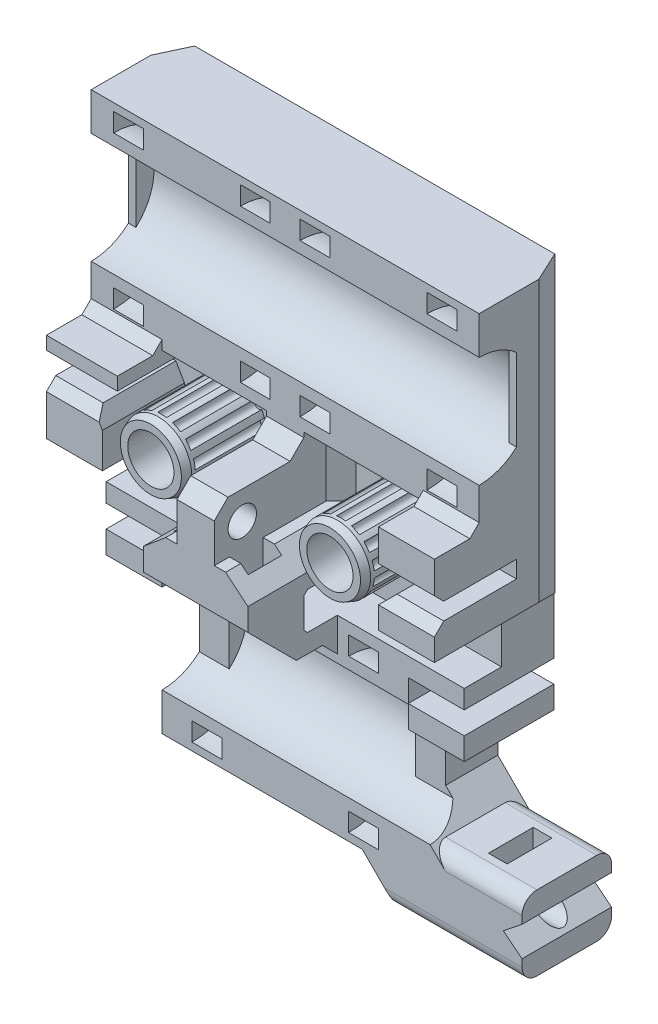
from build123d import *
from OCP.BRepFilletAPI import BRepFilletAPI_MakeChamfer
from build123d.topology import SkipClean

# Parameters (mm, degrees)
BODY_DEPTH                    = 26
SKETCH6_R                     = 4.4563
BELDMOUNT_DEPTH               = 11
SKETCH7_R                     = 3.1
BELTMOUNTCUT_DEPTH            = 5
SKETCH5_R                     = 1.85
MOUNTHOLE_DEPTH               = 26
BEARINGMOUNTHOLESTOP_START    = -3
BEARINGMOUNTHOLESTOP_DEPTH    = 4
BEARINGMOUNTHOLESBOTTOM_START = -8.5
BEARINGMOUNTHOLESBOTTOM_DEPTH = 4
COPYBEARINGMOUNTHOLES_COUNT   = 2
COPYBEARINGMOUNTHOLES_PITCH   = 17
BOTTOMCUT_DEPTH               = 12
RIB2_REACH                    = 67.622
SKETCH18_WALL_W               = 144.222327992
SKETCH18_WALL_H               = 1
RIB3_REACH                    = 64.47
SKETCH19_WALL_W               = 137.91826644
SKETCH19_WALL_H               = 4
BOSS_EXTRUDE5_DEPTH           = 7
CHAMFER3_SIZE                 = 2.5
CHAMFER3_SIZE2                = 2.979383981
RIB4_DEPTH                    = 2.5
SKETCH25_W                    = 2.5
SKETCH25_H                    = 4.5
WIREZIP_DEPTH                 = 18
BOSS_EXTRUDE6_START           = -12
SKETCH26_W                    = 7.5
SKETCH26_H                    = 3
BOSS_EXTRUDE6_DEPTH           = 12
SKETCH28_R                    = 1.9
CUT_EXTRUDE8_DEPTH            = 67.592044884
SKETCH29_R                    = 0.6
BELT_ROWS_DEPTH               = 9.5
BELT_TONEL_DEPTH              = 68.514816462
ENDSTOPFINGER_DEPTH           = 12
SKETCH20_W                    = 7.5
SKETCH20_H                    = 5.5
SKETCH20_H_2                  = 4.2
SKETCH20_W_2                  = 9.5
SKETCH20_H_3                  = 3
SKETCH20_H_4                  = 6.7
BELTFIX_DEPTH                 = 11
CHAMFER5_SIZE                 = 2
CHAMFER5_SIZE2                = 1.154700538
CHAMFER2_SIZE                 = 1.25
SKETCH34_R                    = 1.6
CUT_EXTRUDE11_DEPTH           = 12
CUT_EXTRUDE9_START            = -5
CUT_EXTRUDE9_DEPTH            = 2.5
CHAMFER14_SIZE                = 5
CHAMFER7_SIZE                 = 4
CHAMFER7_SIZE2                = 1.865230633
MOUNTCHAMFER_SIZE2            = 0.363970234
MOUNTCHAMFER_SIZE             = 1
CHAMFER15_SIZE                = 3
CHAMFER18_SIZE                = 1.25
FILLET1_R                     = 2
CHAMFER19_SIZE                = 2


with BuildPart() as part:
    # Sketch3 → Body (new body)
    with BuildSketch(Plane(origin=(60, 0, 0), x_dir=(0, 0, -1), z_dir=(1, 0, 0))):
        with BuildLine():
            Line((-12.000000104, 37.575003755), (-12.000000104, 32.000003755))
            Line((-12.000000104, 32.000003755), (-7.000000216, 32.000003755))
            Line((-7.000000216, 32.000003755), (-7.000000216, 13.000004783))
            Line((-7.000000216, 13.000004783), (-12.000000104, 13.000004783))
            Line((-12.000000104, 13.000004783), (-12.000000104, 7.425003755))
            ThreePointArc((-12.000000104, 7.425003755), (-4.575000104, 3.755e-06), (-12.000000104, -7.424996245))
            Line((-12.000000104, -7.424996245), (-12.000000104, -12.499996245))
            Line((-12.000000104, -12.499996245), (0, -12.499996245))
            Line((0, -12.499996245), (0, 57.500003755))
            Line((0, 57.500003755), (-12.000000104, 57.500003755))
            Line((-12.000000104, 57.500003755), (-12.000000104, 52.425003755))
            ThreePointArc((-12.000000104, 52.425003755), (-4.575000104, 45.000003755), (-12.000000104, 37.575003755))
        make_face()
    extrude(amount=BODY_DEPTH)

    # Sketch6 → BeldMount (add)
    with BuildSketch(Plane.XY.offset(7.000000216)):
        with Locations(Location((72, 24.575003755, 0), (0, 0, 90))):
            Circle(SKETCH6_R)
    extrude(amount=BELDMOUNT_DEPTH)

    # Sketch7 → BeltMountCut (cut)
    with BuildSketch(Plane.XY.offset(18.000000216)):
        with Locations((72, 24.575003755)):
            Circle(SKETCH7_R)
    extrude(amount=-BELTMOUNTCUT_DEPTH, mode=Mode.SUBTRACT)

    # Sketch5 → MountHole (cut)
    with BuildSketch(Plane(origin=(0, 0, 0), x_dir=(-1, 0, 0), z_dir=(0, 0, -1))):
        with Locations((-72, 24.575003755)):
            Circle(SKETCH5_R)
    extrude(amount=-MOUNTHOLE_DEPTH, mode=Mode.SUBTRACT)

    # Sketch12 → BearingMountHolesTop (cut)
    with BuildSketch(Plane(origin=(86, 0, 0), x_dir=(0, 0, -1), z_dir=(1, 0, 0)).offset(BEARINGMOUNTHOLESTOP_START)):
        with BuildLine():
            Line((-12.000000104, 56.47731591), (-12.000000104, 53.982248966))
            ThreePointArc((-12.000000104, 53.982248966), (-3.017754893, 45.000003755), (-12.000000104, 36.017758544))
            Line((-12.000000104, 36.017758544), (-12.000000104, 33.5226916))
            ThreePointArc((-12.000000104, 33.5226916), (-0.522687949, 45.000003755), (-12.000000104, 56.47731591))
        make_face()
    bearingmountholestop = extrude(amount=-BEARINGMOUNTHOLESTOP_DEPTH, mode=Mode.SUBTRACT)

    # Sketch15 → BearingMountHolesBottom (cut)
    with BuildSketch(Plane.ZY.offset(-60).offset(BEARINGMOUNTHOLESBOTTOM_START)):
        with BuildLine():
            Line((12.000000104, 8.999900377), (12.000000104, 11.477181665))
            ThreePointArc((12.000000104, 11.477181665), (0.522822195, 3.755e-06), (12.000000104, -11.477174154))
            Line((12.000000104, -11.477174154), (12.000000104, -8.999892867))
            ThreePointArc((12.000000104, -8.999892867), (3.000103482, 3.755e-06), (12.000000104, 8.999900377))
        make_face()
    extrude(amount=-BEARINGMOUNTHOLESBOTTOM_DEPTH, mode=Mode.SUBTRACT)

    # CopyBearingMountHoles: BearingMountHolesTop ×2
    with Locations(*[(-i * COPYBEARINGMOUNTHOLES_PITCH, 0, 0) for i in range(1, COPYBEARINGMOUNTHOLES_COUNT)]):
        add(bearingmountholestop, mode=Mode.SUBTRACT)

    # Sketch16 → BottomCut (cut)
    with BuildSketch(Plane(origin=(0, 0, 0), x_dir=(-1, 0, 0), z_dir=(0, 0, -1))):
        Polygon((-86, 20.000003755), (-84, 20.000003755), (-84, 10.500003755), (-76.5, 10.500003755), (-76.5, -12.499996245), (-86, -12.499996245), align=None)
    extrude(amount=-BOTTOMCUT_DEPTH, mode=Mode.SUBTRACT)

    # Sketch18 wall → Rib2 (add, up to next)
    with BuildSketch(Plane(origin=(86, 45.000003756, 7), x_dir=(0, -1, 0), z_dir=(0, 0, -1)), mode=Mode.PRIVATE) as rib2_sk1:
        with Locations((0, 0.5)):
            Rectangle(SKETCH18_WALL_W, SKETCH18_WALL_H)
    rib2_tool1 = extrude(rib2_sk1.sketch, amount=RIB2_REACH, mode=Mode.PRIVATE) - part.part
    add(rib2_tool1.solids().sort_by_distance((86, 45.000003756, 7))[0])

    # Sketch19 wall → Rib3 (add, up to next)
    with BuildSketch(Plane(origin=(76.5, 3.756e-06, 7), x_dir=(0, -1, 0), z_dir=(0, 0, -1)), mode=Mode.PRIVATE) as rib3_sk1:
        with Locations((0, 2)):
            Rectangle(SKETCH19_WALL_W, SKETCH19_WALL_H)
    rib3_tool1 = extrude(rib3_sk1.sketch, amount=RIB3_REACH, mode=Mode.PRIVATE) - part.part
    add(rib3_tool1.solids().sort_by_distance((76.5, 3.756e-06, 7))[0])

    # Sketch22 → Boss-Extrude5 (add)
    with BuildSketch(Plane(origin=(60, 0, 0), x_dir=(0, 0, -1), z_dir=(1, 0, 0))):
        Polygon((-7.000000216, 22.500004783), (-7.000000216, 10.500003755), (-17.500000209, 10.500003755), (-24.000000209, 17.000000924), (-24.000000209, 22.500004783), align=None)
    extrude(amount=BOSS_EXTRUDE5_DEPTH)

    # Chamfer3
    chamfer3_edges = [part.edges().sort_by_distance(p)[0] for p in [
        (67, 22.500004783, 15.500000212),
    ]]
    chamfer3_side = [part.faces().sort_by_distance(p)[0] for p in [
        (67, 17.323799822, 15.154928629),
    ]]
    chamfer(chamfer3_edges, length=CHAMFER3_SIZE, length2=CHAMFER3_SIZE2, reference=chamfer3_side[0])

    # Rib4: read off the stored shape, not the designer's step
    # Rib4 outline → Rib4 (add)
    with BuildSketch(Plane(origin=(60, 0, 0), x_dir=(0, 0, -1), z_dir=(1, 0, 0))):
        Polygon((-22.15884997, 29.524860515), (-24.000000209, 27.683710276), (-24.000000209, 22.500004783), (-7.000000216, 22.500004783), (-7.000000216, 32.000003755), (-12.000000104, 32.000003755), (-12.000000104, 31.366010754), (-13.841150343, 29.524860515), align=None)
    extrude(amount=RIB4_DEPTH)

    # Sketch25 → WireZip (cut)
    with BuildSketch(Plane(origin=(0, 22.500004783, 0), x_dir=(1, 0, 0), z_dir=(0, 1, 0))):
        with Locations((63.75, -19.71491082)):
            Rectangle(SKETCH25_W, SKETCH25_H)
    extrude(amount=-WIREZIP_DEPTH, mode=Mode.SUBTRACT)

    # Sketch26 → Boss-Extrude6 (add)
    with SkipClean():  # the faces are left unmerged after this step: merging them gives an invalid solid
        with BuildSketch(Plane(origin=(0, 0, 0), x_dir=(-1, 0, 0), z_dir=(0, 0, -1)).offset(BOSS_EXTRUDE6_START)):
            with Locations((-80.25, 6.000003755)):
                Rectangle(SKETCH26_W, SKETCH26_H)
        extrude(amount=BOSS_EXTRUDE6_DEPTH)

    # Sketch28 → Cut-Extrude8 (cut, through all)
    with SkipClean():  # the faces are left unmerged after this step: merging them gives an invalid solid
        with BuildSketch(Plane(origin=(62.5, 0, 0), x_dir=(0, 0, -1), z_dir=(1, 0, 0))):
            with Locations((-20.250000209, 25.774860515)):
                Circle(SKETCH28_R)
        extrude(amount=-CUT_EXTRUDE8_DEPTH, mode=Mode.SUBTRACT)

    # Sketch29 → belt_rows (cut)
    with SkipClean():  # the faces are left unmerged after this step: merging them gives an invalid solid
        with BuildSketch(Plane.XY.offset(7.000000216)):
            with Locations((72, 29.031303755)):
                Circle(SKETCH29_R)
            with Locations((73.956658353, 28.647684126)):
                Circle(SKETCH29_R)
            with Locations((75.553100295, 27.453092541)):
                Circle(SKETCH29_R)
            with Locations((76.47313092, 25.684132514)):
                Circle(SKETCH29_R)
            with Locations((76.534526881, 23.691168274)):
                Circle(SKETCH29_R)
            with Locations((75.725127953, 21.868930829)):
                Circle(SKETCH29_R)
            with Locations((74.205245521, 20.578336655)):
                Circle(SKETCH29_R)
            with Locations((72.275910941, 20.075003755)):
                Circle(SKETCH29_R)
            with Locations((70.319252588, 20.458623384)):
                Circle(SKETCH29_R)
            with Locations((68.722810646, 21.653214969)):
                Circle(SKETCH29_R)
            with Locations((67.802780021, 23.422174996)):
                Circle(SKETCH29_R)
            with Locations((67.74138406, 25.415139237)):
                Circle(SKETCH29_R)
            with Locations((68.550782988, 27.237376681)):
                Circle(SKETCH29_R)
            with Locations((70.07066542, 28.527970855)):
                Circle(SKETCH29_R)
        extrude(amount=BELT_ROWS_DEPTH, mode=Mode.SUBTRACT)

    # Sketch32 → belt_tonel (cut, through all)
    with SkipClean():  # the faces are left unmerged after this step: merging them gives an invalid solid
        with BuildSketch(Plane(origin=(60, 0, 0), x_dir=(0, 0, -1), z_dir=(1, 0, 0))):
            Polygon((-16.500000216, 13.500004783), (-16.000000216, 13.000004783), (-7.000000216, 13.000004783), (-7.000000216, 18.000004783), (-16.000000216, 18.000004783), (-16.500000216, 17.500004783), align=None)
        extrude(amount=BELT_TONEL_DEPTH, mode=Mode.SUBTRACT)

    # Mirror1: read off the stored shape, not the designer's step
    # Mirror1: part across plane


with BuildPart() as part_1:
    add(part.part)
    add(part.part.mirror(Plane(origin=(60, 0, 0), x_dir=(0, 0, 1), z_dir=(1, 0, 0))))

    # Sketch31 → EndStopFinger (add)
    with BuildSketch(Plane(origin=(0, 0, 0), x_dir=(-1, 0, 0), z_dir=(0, 0, -1))):
        Polygon((-91.748254174, -10.499996245), (-91.748254174, -7.499996245), (-76.5, -7.499996245), (-76.5, -12.499996245), (-72.5, -12.499996245), (-72.5, -17.499996245), (-91.748254174, -17.499996245), (-91.748254174, -14.499996245), (-89.248254174, -12.499996245), align=None)
    extrude(amount=-ENDSTOPFINGER_DEPTH)

    # Sketch20 → BeltFix (add)
    with BuildSketch(Plane.XY.offset(7.000000216)):
        with Locations((82.25, 29.250003755)):
            Rectangle(SKETCH20_W, SKETCH20_H)
        with Locations((82.25, 22.100003755)):
            Rectangle(SKETCH20_W, SKETCH20_H_2)
        with Locations((38.75, 30.500003755)):
            Rectangle(SKETCH20_W_2, SKETCH20_H_3)
        with Locations((37.75, 23.350003755)):
            Rectangle(SKETCH20_W, SKETCH20_H_4)
    extrude(amount=BELTFIX_DEPTH)

    # Chamfer5
    chamfer5_edges = [part_1.edges().sort_by_distance(p)[0] for p in [
        (41.5, 26.700003755, 12.500000216),
    ]]
    chamfer5_side = [part_1.faces().sort_by_distance(p)[0] for p in [
        (41.5, 23.350003755, 12.500000216),
    ]]
    chamfer(chamfer5_edges, length=CHAMFER5_SIZE, length2=CHAMFER5_SIZE2, reference=chamfer5_side[0])

    # Chamfer2
    chamfer2_edges = [part_1.edges().sort_by_distance(p)[0] for p in [
        (78.5, 26.500003755, 12.500000216),
        (82.25, 26.500003755, 18.000000216),
        (78.5, 24.200003755, 12.500000216),
        (82.25, 24.200003755, 18.000000216),
        (43.5, 29.000003755, 12.500000216),
        (38.75, 29.000003755, 18.000000216),
        (37.172649731, 26.700003755, 18.000000216),
    ]]
    chamfer(chamfer2_edges, length=CHAMFER2_SIZE)

    # Sketch34 → Cut-Extrude11 (cut)
    with BuildSketch(Plane(origin=(91.748254174, 0, 0), x_dir=(0, 0, -1), z_dir=(1, 0, 0))):
        with Locations((-6, -12.499996245)):
            Circle(SKETCH34_R)
    extrude(amount=-CUT_EXTRUDE11_DEPTH, mode=Mode.SUBTRACT)

    # Sketch33 → Cut-Extrude9 (cut)
    with BuildSketch(Plane(origin=(91.748254174, 0, 0), x_dir=(0, 0, -1), z_dir=(1, 0, 0)).offset(CUT_EXTRUDE9_START)):
        Polygon((-9, -7.499996245), (-3, -7.499996245), (-3, -14.232047052), (-6, -15.96409786), (-9, -14.232047052), align=None)
    extrude(amount=-CUT_EXTRUDE9_DEPTH, mode=Mode.SUBTRACT)

    # Chamfer14
    chamfer14_edges = [part_1.edges().sort_by_distance(p)[0] for p in [
        (72.5, -12.499996245, 6),
    ]]
    chamfer(chamfer14_edges, length=CHAMFER14_SIZE - 0.0001)  # a hair under: the kernel refuses the full size

    # Chamfer7: one chamfer whose edges measure the first distance from different faces: ONE call of the kernel's chamfer builder (chamfer() names one face for all edges)
    chamfer7_edges_1 = [part_1.edges().sort_by_distance(p)[0] for p in [
        (86, 38.750003755, 0),
    ]]
    chamfer7_side_1 = [part_1.faces().sort_by_distance(p)[0] for p in [
        (86, 36.445009582, 6.512997329),
    ]]
    chamfer7_edges_2 = [part_1.edges().sort_by_distance(p)[0] for p in [
        (34, 38.750003755, 0),
    ]]
    chamfer7_side_2 = [part_1.faces().sort_by_distance(p)[0] for p in [
        (34, 36.287720757, 6.512997329),
    ]]
    chamfer7 = BRepFilletAPI_MakeChamfer(part_1.part.solid().wrapped)
    for e in chamfer7_edges_1:
        chamfer7.Add(CHAMFER7_SIZE, CHAMFER7_SIZE2, e.wrapped, chamfer7_side_1[0].wrapped)  # the first distance lies on this face
    for e in chamfer7_edges_2:
        chamfer7.Add(CHAMFER7_SIZE, CHAMFER7_SIZE2, e.wrapped, chamfer7_side_2[0].wrapped)  # the first distance lies on this face
    add(Compound.cast(chamfer7.Shape()), mode=Mode.REPLACE)

    # MountChamfer
    mountchamfer_edges = [part_1.edges().sort_by_distance(p)[0] for p in [
        (72, 20.118703755, 18.000000216),
        (48, 20.118703755, 18.000000216),
    ]]
    chamfer(mountchamfer_edges, length=MOUNTCHAMFER_SIZE, length2=MOUNTCHAMFER_SIZE2)

    # Chamfer15
    # the kernel refuses this chamfer: 3 mm, written as the material it adds along each edge
    with BuildSketch(Plane(origin=(76.5, -7.499996245, 0), x_dir=(0, 1, 0), z_dir=(0, 0, 1))) as chamfer15_piece_1_section:
        Polygon((CHAMFER15_SIZE, 0), (0, -CHAMFER15_SIZE), (0, 0), align=None)
    chamfer15_piece_1 = extrude(amount=19.715048964, mode=Mode.PRIVATE)
    chamfer15_piece_1 = chamfer15_piece_1 - Plane(origin=(76.5, 3.755e-06, 12.000000104), x_dir=(0, 1, 0), z_dir=(-1, 0, 0)) * Cylinder(7.425, 52, mode=Mode.PRIVATE)
    chamfer15_piece_1 = split(chamfer15_piece_1, bisect_by=Plane(origin=(76.5, -7.499996245, 7), z_dir=(0, 0, -1)), keep=Keep.TOP, mode=Mode.PRIVATE)
    add(chamfer15_piece_1)
    with BuildSketch(Plane(origin=(76.5, -7.499996245, 0), x_dir=(0, 1, 0), z_dir=(0, 0, 1))) as chamfer15_piece_2_section:
        Polygon((CHAMFER15_SIZE, 0), (0, -CHAMFER15_SIZE), (0, 0), align=None)
    chamfer15_piece_2 = extrude(amount=19.715048964, mode=Mode.PRIVATE)
    chamfer15_piece_2 = split(chamfer15_piece_2, bisect_by=Plane(origin=(76.5, -7.499996245, 12.000000104), z_dir=(0, 0, -1)), keep=Keep.TOP, mode=Mode.PRIVATE)
    chamfer15_piece_2 = chamfer15_piece_2 - Plane(origin=(76.5, 3.755e-06, 12.000000104), x_dir=(0, 1, 0), z_dir=(-1, 0, 0)) * Cylinder(7.425, 52, mode=Mode.PRIVATE)
    chamfer15_piece_2 = split(chamfer15_piece_2, bisect_by=Plane(origin=(76.5, -7.499996245, 7), z_dir=(0, 0, 1)), keep=Keep.TOP, mode=Mode.PRIVATE)
    add(chamfer15_piece_2)
    with BuildSketch(Plane(origin=(76.5, -7.499996245, 0), x_dir=(0, 1, 0), z_dir=(0, 0, 1))) as chamfer15_piece_3_section:
        Polygon((CHAMFER15_SIZE, 0), (0, -CHAMFER15_SIZE), (0, 0), align=None)
    chamfer15_piece_3 = extrude(amount=19.715048964, mode=Mode.PRIVATE)
    chamfer15_piece_3 = chamfer15_piece_3 & Plane(origin=(76.5, 3.755e-06, 12.000000104), x_dir=(0, 1, 0), z_dir=(-1, 0, 0)) * Cylinder(7.425, 52, mode=Mode.PRIVATE)
    chamfer15_piece_3 = split(chamfer15_piece_3, bisect_by=Plane(origin=(76.5, -7.499996245, 7), z_dir=(0, 0, -1)), keep=Keep.TOP, mode=Mode.PRIVATE)
    add(chamfer15_piece_3)

    # Chamfer16
    # the kernel refuses this chamfer: 2 mm, written as the material it takes off along each edge
    with BuildSketch(Plane(origin=(63.86319104, -8.863087285, 0), x_dir=(0, 0, 1), z_dir=(0.7071067811865472, -0.7071067811865478, 0))) as chamfer16_piece_1_section:
        with BuildLine():
            Line((2.056568542, 0.056568542), (-0.056568542, -2.056568542))
            Line((-0.056568542, -2.056568542), (-0.096568542, -2.056568542))
            ThreePointArc((-0.096568542, -2.056568542), (-0.04, -1.028284271), (-0.04, 0))
            Line((-0.04, 0), (0, 0.04))
            ThreePointArc((0, 0.04), (1.028284271, 0.04), (2.056568542, 0.096568542))
            Line((2.056568542, 0.096568542), (2.056568542, 0.056568542))
        make_face()
    chamfer16_piece_1 = extrude(amount=17.357658342, mode=Mode.PRIVATE)
    chamfer16_piece_1 = split(chamfer16_piece_1, bisect_by=Plane(origin=(63.86319104, -12.499996245, 0), z_dir=(0, -1, 0)), keep=Keep.TOP, mode=Mode.PRIVATE)
    add(chamfer16_piece_1, mode=Mode.SUBTRACT)
    with BuildSketch(Plane(origin=(63.86319104, -8.863087285, 12.000000104), x_dir=(0, 0, -1), z_dir=(0.7071067811865472, -0.7071067811865478, 0))) as chamfer16_piece_2_section:
        with BuildLine():
            Line((2.056568542, -0.056568542), (-0.056568542, 2.056568542))
            Line((-0.056568542, 2.056568542), (-0.096568542, 2.056568542))
            ThreePointArc((-0.096568542, 2.056568542), (-0.04, 1.028284271), (-0.04, 0))
            Line((-0.04, 0), (0, -0.04))
            ThreePointArc((0, -0.04), (1.028284271, -0.04), (2.056568542, -0.096568542))
            Line((2.056568542, -0.096568542), (2.056568542, -0.056568542))
        make_face()
    chamfer16_piece_2 = extrude(amount=17.357658342, mode=Mode.PRIVATE)
    chamfer16_piece_2 = split(chamfer16_piece_2, bisect_by=Plane(origin=(63.86319104, -12.499996245, 12.000000104), z_dir=(0, -1, 0)), keep=Keep.TOP, mode=Mode.PRIVATE)
    add(chamfer16_piece_2, mode=Mode.SUBTRACT)

    # Chamfer18
    chamfer18_edges = [part_1.edges().sort_by_distance(p)[0] for p in [
        (82.25, 32.000003755, 12.000000104),
        (38.75, 32.000003755, 12.000000104),
    ]]
    chamfer(chamfer18_edges, length=CHAMFER18_SIZE)

    # Fillet1
    fillet1_edges = [part_1.edges().sort_by_distance(p)[0] for p in [
        (83.538390649, -17.499996245, 0),
        (85.624127087, -7.499996245, 0),
        (85.624127087, -7.499996245, 12),
        (83.538390575, -17.499996245, 12),
    ]]
    fillet(fillet1_edges, radius=FILLET1_R)

    # Chamfer19
    # the kernel refuses this chamfer: 2 mm, written as the material it adds along each edge
    with BuildSketch(Plane(origin=(57.356634024, 32.000003755, 7.000000216), x_dir=(0, -1, 0), z_dir=(1, 0, 0))) as chamfer19_piece_1:
        Polygon((CHAMFER19_SIZE, 0), (0, -CHAMFER19_SIZE), (0, 0), align=None)
    extrude(amount=26.286731952)
    with BuildSketch(Plane(origin=(84, 20.000003755, 7.000000216), x_dir=(0, -1, 0), z_dir=(-1, 0, 0)), Plane(origin=(41.5, 20.000003755, 7.000000216), x_dir=(0, -1, 0), z_dir=(-1, 0, 0))) as chamfer19_piece_2:
        Polygon((CHAMFER19_SIZE, 0), (0, CHAMFER19_SIZE), (0, 0), align=None)
    extrude(amount=5.5)
    with BuildSketch(Plane(origin=(62.643365976, 32.000003755, 7.000000216), x_dir=(0, -1, 0), z_dir=(-1, 0, 0))) as chamfer19_piece_3:
        Polygon((CHAMFER19_SIZE, 0), (0, CHAMFER19_SIZE), (0, 0), align=None)
    extrude(amount=24.286731952)
    with BuildSketch(Plane(origin=(84, 20.000003755, 0), x_dir=(0, -1, 0), z_dir=(0, 0, 1))) as chamfer19_piece_4_section:
        Polygon((CHAMFER19_SIZE, 0), (0, CHAMFER19_SIZE), (0, 0), align=None)
    chamfer19_piece_4 = extrude(amount=7.000000216, mode=Mode.PRIVATE)
    chamfer19_piece_4 = split(chamfer19_piece_4, bisect_by=Plane(origin=(84.110698723, 20.000003755, -0.051619662), z_dir=(-0.9063077870366497, 0, 0.42261826174070005)), keep=Keep.TOP, mode=Mode.PRIVATE)
    add(chamfer19_piece_4)
    with BuildSketch(Plane(origin=(53, 10.500003755, 12.000000104), x_dir=(0, 0, 1), z_dir=(1, 0, 0))) as chamfer19_piece_5:
        Polygon((CHAMFER19_SIZE, 0), (0, CHAMFER19_SIZE), (0, 0), align=None)
    extrude(amount=14)
    with BuildSketch(Plane(origin=(62.5, 17.356638807, 7.000000216), x_dir=(1.0, 0, 3.341860121963691e-11), z_dir=(0, 1, 0))) as chamfer19_piece_6_section:
        Polygon((CHAMFER19_SIZE, 0), (0, -CHAMFER19_SIZE), (0, 0), align=None)
    chamfer19_piece_6 = extrude(amount=14.643364948, mode=Mode.PRIVATE)
    chamfer19_piece_6 = split(chamfer19_piece_6, bisect_by=Plane(origin=(62.5, 18.000004783, 7.000000216), z_dir=(0, 1, 0)), keep=Keep.TOP, mode=Mode.PRIVATE)
    add(chamfer19_piece_6)
    with BuildSketch(Plane(origin=(36, 20.000003755, 0), x_dir=(-1, 0, 0), z_dir=(0, 0, 1))) as chamfer19_piece_7_section:
        Polygon((CHAMFER19_SIZE, 0), (0, CHAMFER19_SIZE), (0, 0), align=None)
    chamfer19_piece_7 = extrude(amount=7.000000216, mode=Mode.PRIVATE)
    chamfer19_piece_7 = split(chamfer19_piece_7, bisect_by=Plane(origin=(35.889301277, 20.000003755, -0.051619662), z_dir=(0.9063077870366497, 0, 0.42261826174070005)), keep=Keep.TOP, mode=Mode.PRIVATE)
    add(chamfer19_piece_7)
    with BuildSketch(Plane(origin=(57.5, 17.356638807, 7.000000216), x_dir=(-1.0, 0, 3.341860121963691e-11), z_dir=(0, 1, 0))) as chamfer19_piece_8_section:
        Polygon((CHAMFER19_SIZE, 0), (0, CHAMFER19_SIZE), (0, 0), align=None)
    chamfer19_piece_8 = extrude(amount=14.643364948, mode=Mode.PRIVATE)
    chamfer19_piece_8 = split(chamfer19_piece_8, bisect_by=Plane(origin=(57.5, 18.000004783, 7.000000216), z_dir=(0, 1, 0)), keep=Keep.TOP, mode=Mode.PRIVATE)
    add(chamfer19_piece_8)
    with BuildSketch(Plane(origin=(89.143365976, 20.000003755, 7.000000216), x_dir=(0, -1, 0), z_dir=(-1, 0, 0))) as chamfer19_piece_9a_section:
        Polygon((CHAMFER19_SIZE, 0), (0, CHAMFER19_SIZE), (0, 0), align=None)
    chamfer19_piece_9a = extrude(amount=10.643365976, mode=Mode.PRIVATE)
    chamfer19_piece_9a = split(chamfer19_piece_9a, bisect_by=Plane(origin=(86, 20.000003755, 7.000000216), z_dir=(-1, 0, 0)), keep=Keep.TOP, mode=Mode.PRIVATE)
    chamfer19_piece_9a = split(chamfer19_piece_9a, bisect_by=Plane(origin=(84, 20.000003755, 7.000000216), z_dir=(1, 0, 0)), keep=Keep.TOP, mode=Mode.PRIVATE)
    with BuildSketch(Plane(origin=(84, 20.000003755, 0), x_dir=(0, -1, 0), z_dir=(0, 0, 1))) as chamfer19_piece_9b_section:
        Polygon((CHAMFER19_SIZE, 0), (0, CHAMFER19_SIZE), (0, 0), align=None)
    chamfer19_piece_9b = extrude(amount=12.143366192, mode=Mode.PRIVATE)
    chamfer19_piece_9b = split(chamfer19_piece_9b, bisect_by=Plane(origin=(84, 20.000003755, 7.000000216), z_dir=(0, 0, 1)), keep=Keep.TOP, mode=Mode.PRIVATE)
    chamfer19_piece_9 = chamfer19_piece_9a & chamfer19_piece_9b
    add(chamfer19_piece_9)
    with BuildSketch(Plane(origin=(41.5, 20.000003755, 7.000000216), x_dir=(0, -1, 0), z_dir=(-1, 0, 0))) as chamfer19_piece_10a_section:
        Polygon((CHAMFER19_SIZE, 0), (0, CHAMFER19_SIZE), (0, 0), align=None)
    chamfer19_piece_10a = extrude(amount=10.643365976, mode=Mode.PRIVATE)
    chamfer19_piece_10a = split(chamfer19_piece_10a, bisect_by=Plane(origin=(34, 20.000003755, 7.000000216), z_dir=(1, 0, 0)), keep=Keep.TOP, mode=Mode.PRIVATE)
    chamfer19_piece_10a = split(chamfer19_piece_10a, bisect_by=Plane(origin=(36, 20.000003755, 7.000000216), z_dir=(-1, 0, 0)), keep=Keep.TOP, mode=Mode.PRIVATE)
    with BuildSketch(Plane(origin=(36, 20.000003755, 0), x_dir=(-1, 0, 0), z_dir=(0, 0, 1))) as chamfer19_piece_10b_section:
        Polygon((CHAMFER19_SIZE, 0), (0, CHAMFER19_SIZE), (0, 0), align=None)
    chamfer19_piece_10b = extrude(amount=12.143366192, mode=Mode.PRIVATE)
    chamfer19_piece_10b = split(chamfer19_piece_10b, bisect_by=Plane(origin=(36, 20.000003755, 7.000000216), z_dir=(0, 0, 1)), keep=Keep.TOP, mode=Mode.PRIVATE)
    chamfer19_piece_10 = chamfer19_piece_10a & chamfer19_piece_10b
    add(chamfer19_piece_10)


solid = part_1.part
